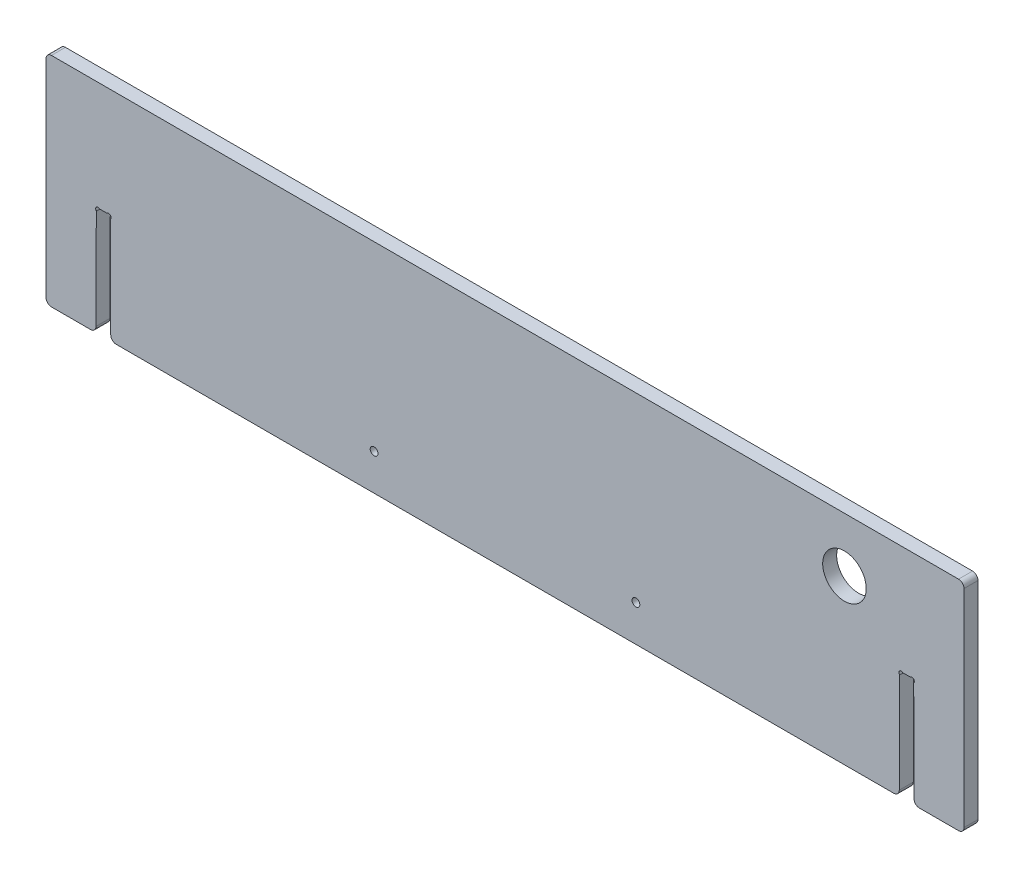
from build123d import *

# Parameters (mm, degrees)
ESQUISSE1_W         = 590.5
ESQUISSE1_H         = 280.25
BOSS_EXTRUDE1_DEPTH = 18
CUT_EXTRUDE1_DEPTH  = 654.876374019
ESQUISSE3_R         = 5
CUT_EXTRUDE2_DEPTH  = 654.876374019
CONG_1_R            = 7
SKETCH1_R           = 28
CUT_EXTRUDE3_DEPTH  = 1214.929595364


with BuildPart() as part:
    # Esquisse1 → Boss-Extrude1 (new body)
    with BuildSketch(Plane.XY):
        with Locations((295.25, 140.125)):
            Rectangle(ESQUISSE1_W, ESQUISSE1_H)
    extrude(amount=BOSS_EXTRUDE1_DEPTH)

    # Esquisse2 → Cut-Extrude1 (cut, through all)
    with BuildSketch(Plane.XY.offset(18)):
        with BuildLine():
            Line((69.477649355, 140.125), (78.147350645, 140.125))
            ThreePointArc((78.147350645, 140.125), (78.480108702, 140.181987765), (78.774940482, 140.346455848))
            ThreePointArc((78.774940482, 140.346455848), (82.906698158, 140.130786526), (83.144207297, 136.00022674))
            ThreePointArc((83.144207297, 136.00022674), (82.981699427, 135.705678195), (82.926062442, 135.373906919))
            Line((82.926062442, 135.373906919), (83.3125, 0))
            Line((83.3125, 0), (64.3125, 0))
            Line((64.3125, 0), (64.698937558, 135.373906919))
            ThreePointArc((64.698937558, 135.373906919), (64.643300573, 135.705678195), (64.480792703, 136.00022674))
            ThreePointArc((64.480792703, 136.00022674), (64.718301842, 140.130786526), (68.850059518, 140.346455848))
            ThreePointArc((68.850059518, 140.346455848), (69.144891298, 140.181987765), (69.477649355, 140.125))
        make_face()
    extrude(amount=-CUT_EXTRUDE1_DEPTH, mode=Mode.SUBTRACT)

    # Esquisse3 → Cut-Extrude2 (cut, through all)
    with BuildSketch(Plane.XY.offset(18)):
        with Locations((422.0625, 46.708333333)):
            Circle(ESQUISSE3_R)
    extrude(amount=-CUT_EXTRUDE2_DEPTH, mode=Mode.SUBTRACT)

    # Congé1
    cong_1_edges = [part.edges().sort_by_distance(p)[0] for p in [
        (83.3125, 0, 9),
        (64.3125, 0, 9),
        (0, 0, 9),
        (0, 280.25, 9),
    ]]
    fillet(cong_1_edges, radius=CONG_1_R)

    # Symétrie1: part across plane


with BuildPart() as part_1:
    add(part.part)
    add(part.part.mirror(Plane(origin=(590.5, 0, 18), x_dir=(0, 0, 1), z_dir=(-1, 0, 0))))

    # Sketch1 → Cut-Extrude3 (cut, through all)
    with BuildSketch(Plane.XY.offset(18)):
        with Locations((1027.1875, 210.25)):
            Circle(SKETCH1_R)
    extrude(amount=-CUT_EXTRUDE3_DEPTH, mode=Mode.SUBTRACT)


solid = part_1.part
